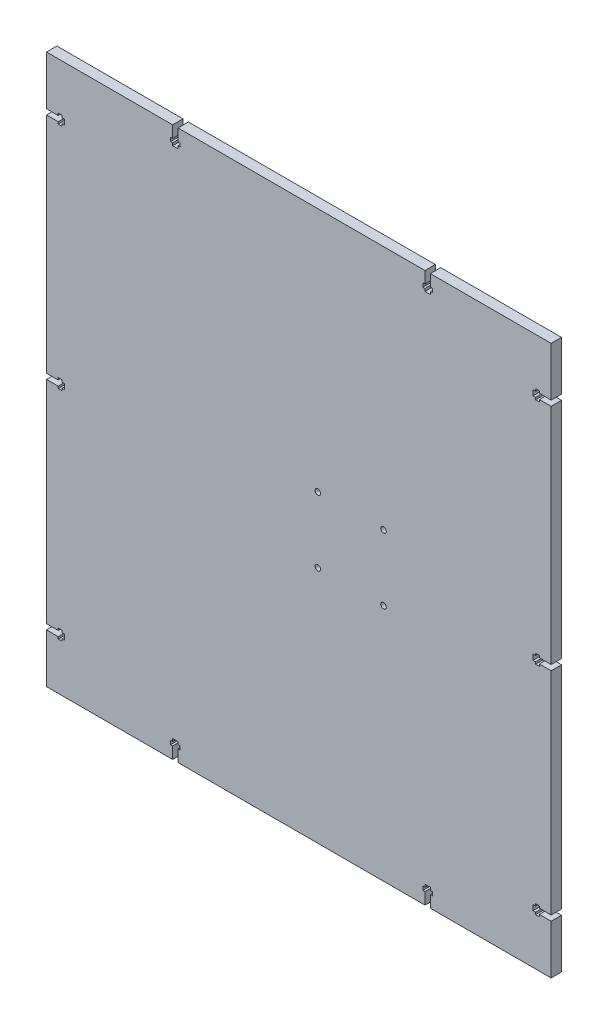
from build123d import *

# Parameters (mm, degrees)
SKETCH_1_R      = 1.6
EXTRUDE_1_DEPTH = 6


with BuildPart() as part:
    # Эскиз1 → Бобышка-Вытянуть1 (new body)
    with BuildSketch(Plane.XY):
        Polygon((-142.627592608, 165.17616196), (-69.627592608, 165.17616196), (-69.627592608, 158.37616196), (-70.827592608, 158.37616196), (-70.827592608, 156.17616196), (-69.627592608, 156.17616196), (-69.627592608, 154.67616196), (-66.527592608, 154.67616196), (-66.527592608, 156.17616196), (-65.327592608, 156.17616196), (-65.327592608, 158.37616196), (-66.527592608, 158.37616196), (-66.527592608, 165.17616196), (76.372407392, 165.17616196), (76.372407392, 158.37616196), (75.172407392, 158.37616196), (75.172407392, 156.17616196), (76.372407392, 156.17616196), (76.372407392, 154.67616196), (79.472407392, 154.67616196), (79.472407392, 156.17616196), (80.672407392, 156.17616196), (80.672407392, 158.37616196), (79.472407392, 158.37616196), (79.472407392, 165.17616196), (149.372407392, 165.17616196), (149.372407392, 136.72616196), (142.572407392, 136.72616196), (142.572407392, 137.92616196), (140.372407392, 137.92616196), (140.372407392, 136.72616196), (138.872407392, 136.72616196), (138.872407392, 133.62616196), (140.372407392, 133.62616196), (140.372407392, 132.42616196), (142.572407392, 132.42616196), (142.572407392, 133.62616196), (149.372407392, 133.62616196), (149.372407392, 132.07616196), (149.372407392, 4.22616196), (142.572407392, 4.22616196), (142.572407392, 5.42616196), (140.372407392, 5.42616196), (140.372407392, 4.22616196), (138.872407392, 4.22616196), (138.872407392, 1.12616196), (140.372407392, 1.12616196), (140.372407392, -0.07383804), (142.572407392, -0.07383804), (142.572407392, 1.12616196), (149.372407392, 1.12616196), (149.372407392, -121.27383804), (142.572407392, -121.27383804), (142.572407392, -120.07383804), (140.372407392, -120.07383804), (140.372407392, -121.27383804), (138.872407392, -121.27383804), (138.872407392, -124.37383804), (140.372407392, -124.37383804), (140.372407392, -125.57383804), (142.572407392, -125.57383804), (142.572407392, -124.37383804), (149.372407392, -124.37383804), (149.372407392, -152.82383804), (79.472407392, -152.82383804), (79.472407392, -146.02383804), (80.672407392, -146.02383804), (80.672407392, -143.82383804), (79.472407392, -143.82383804), (79.472407392, -142.32383804), (76.372407392, -142.32383804), (76.372407392, -143.82383804), (75.172407392, -143.82383804), (75.172407392, -146.02383804), (76.372407392, -146.02383804), (76.372407392, -152.82383804), (-66.527592608, -152.82383804), (-66.527592608, -146.02383804), (-65.327592608, -146.02383804), (-65.327592608, -143.82383804), (-66.527592608, -143.82383804), (-66.527592608, -142.32383804), (-69.627592608, -142.32383804), (-69.627592608, -143.82383804), (-70.827592608, -143.82383804), (-70.827592608, -146.02383804), (-69.627592608, -146.02383804), (-69.627592608, -152.82383804), (-142.627592608, -152.82383804), (-142.627592608, -124.37383804), (-135.827592608, -124.37383804), (-135.827592608, -125.57383804), (-133.627592608, -125.57383804), (-133.627592608, -124.37383804), (-132.127592608, -124.37383804), (-132.127592608, -121.27383804), (-133.627592608, -121.27383804), (-133.627592608, -120.07383804), (-135.827592608, -120.07383804), (-135.827592608, -121.27383804), (-142.627592608, -121.27383804), (-142.627592608, 1.12616196), (-135.827592608, 1.12616196), (-135.827592608, -0.07383804), (-133.627592608, -0.07383804), (-133.627592608, 1.12616196), (-132.127592608, 1.12616196), (-132.127592608, 4.22616196), (-133.627592608, 4.22616196), (-133.627592608, 5.42616196), (-135.827592608, 5.42616196), (-135.827592608, 4.22616196), (-142.627592608, 4.22616196), (-142.627592608, 133.62616196), (-135.827592608, 133.62616196), (-135.827592608, 132.42616196), (-133.627592608, 132.42616196), (-133.627592608, 133.62616196), (-132.127592608, 133.62616196), (-132.127592608, 136.72616196), (-133.627592608, 136.72616196), (-133.627592608, 137.92616196), (-135.827592608, 137.92616196), (-135.827592608, 136.72616196), (-142.627592608, 136.72616196), align=None)
        with Locations((14.372407392, -14.77383804)):
            Circle(SKETCH_1_R, mode=Mode.SUBTRACT)
        with Locations((52.372407392, 23.22616196)):
            Circle(SKETCH_1_R, mode=Mode.SUBTRACT)
        with Locations((14.372407392, 23.22616196)):
            Circle(SKETCH_1_R, mode=Mode.SUBTRACT)
        with Locations((52.372407392, -14.77383804)):
            Circle(SKETCH_1_R, mode=Mode.SUBTRACT)
    extrude(amount=EXTRUDE_1_DEPTH)


solid = part.part
